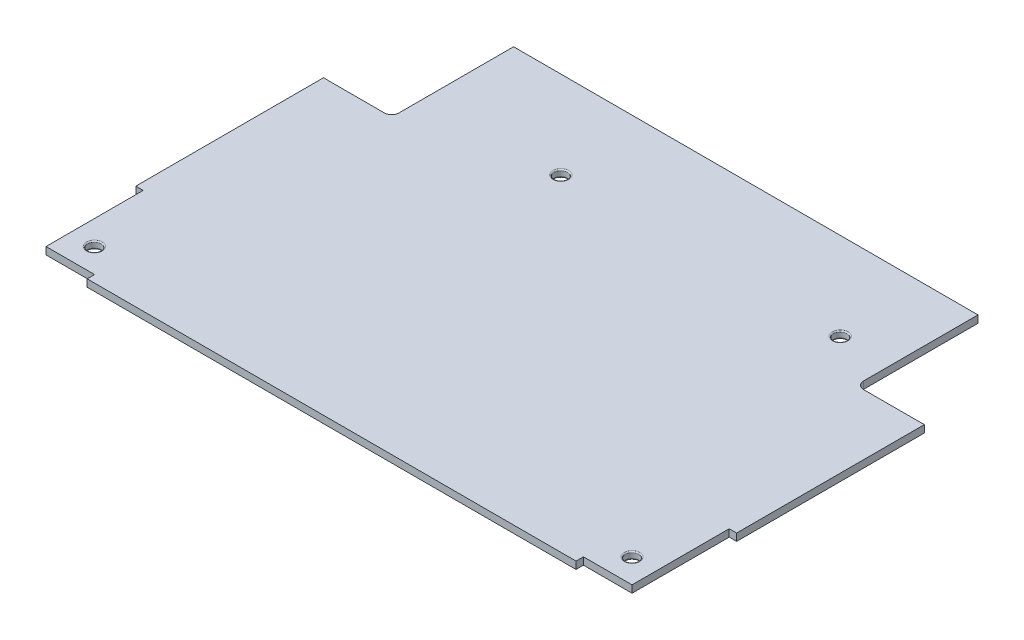
from build123d import *

# Parameters (mm, degrees)
SKETCH1_W           = 247.3
SKETCH1_H           = 170.475
BOSS_EXTRUDE1_DEPTH = 3
CUT_EXTRUDE2_DEPTH  = 151.212362694
SKETCH2_R           = 2.75
CUT_EXTRUDE1_DEPTH  = 151.212362694
FILLET1_R           = 0.5
SKETCH10_R          = 2.75
CUT_EXTRUDE8_DEPTH  = 151.212362694
FILLET4_R           = 0.5
CUT_EXTRUDE11_DEPTH = 151.212362694


with BuildPart() as part:
    # Sketch1 → Boss-Extrude1 (new body)
    with BuildSketch(Plane(origin=(0, 0, 0), x_dir=(1, 0, 0), z_dir=(0, 1, 0))):
        Rectangle(SKETCH1_W, SKETCH1_H)
    extrude(amount=BOSS_EXTRUDE1_DEPTH)

    # Sketch4 → Cut-Extrude2 (cut, through all)
    with BuildSketch(Plane(origin=(0, 3, 0), x_dir=(1, 0, 0), z_dir=(0, 1, 0))):
        Polygon((-123.65, -85.2375), (-120.6, -85.2375), (-100.6, -85.2375), (-100.6, -82.1875), (-120.6, -82.1875), (-120.6, -42.1875), (-123.65, -42.1875), align=None)
        Polygon((100.6, -85.2375), (100.6, -82.1875), (120.6, -82.1875), (120.6, -42.1875), (123.65, -42.1875), (123.65, -85.2375), (120.6, -85.2375), align=None)
    extrude(amount=-CUT_EXTRUDE2_DEPTH, mode=Mode.SUBTRACT)

    # Sketch2 → Cut-Extrude1 (cut, through all)
    with BuildSketch(Plane(origin=(0, 3, 0), x_dir=(1, 0, 0), z_dir=(0, 1, 0))):
        with Locations((-110.65, 55.2375)):
            Circle(SKETCH2_R)
        with Locations((110.65, 55.2375)):
            Circle(SKETCH2_R)
        with Locations((-110.65, -72.2375)):
            Circle(SKETCH2_R)
        with Locations((110.65, -72.2375)):
            Circle(SKETCH2_R)
    extrude(amount=-CUT_EXTRUDE1_DEPTH, mode=Mode.SUBTRACT)

    # Fillet1
    fillet1_edges = [part.edges().sort_by_distance(p)[0] for p in [
        (-113.4, 3, -55.2375),
        (-113.4, 0, -55.2375),
        (107.9, 3, -55.2375),
        (107.9, 0, -55.2375),
        (-113.4, 3, 72.2375),
        (-113.4, 0, 72.2375),
        (107.9, 3, 72.2375),
        (107.9, 0, 72.2375),
    ]]
    fillet(fillet1_edges, radius=FILLET1_R)

    # Sketch10 → Cut-Extrude8 (cut, through all)
    with BuildSketch(Plane(origin=(0, 3, 0), x_dir=(1, 0, 0), z_dir=(0, 1, 0))):
        with Locations((74.85, 49.2625)):
            Circle(SKETCH10_R)
        with Locations((-40.15, 49.2625)):
            Circle(SKETCH10_R)
    extrude(amount=-CUT_EXTRUDE8_DEPTH, mode=Mode.SUBTRACT)

    # Fillet4
    fillet4_edges = [part.edges().sort_by_distance(p)[0] for p in [
        (-42.9, 3, -49.2625),
        (-42.9, 0, -49.2625),
        (72.1, 3, -49.2625),
        (72.1, 0, -49.2625),
    ]]
    fillet(fillet4_edges, radius=FILLET4_R)

    # Sketch13 → Cut-Extrude11 (cut, through all)
    with BuildSketch(Plane.XZ):
        with BuildLine():
            Line((122.675, -35.0605), (98.625, -35.0605))
            ThreePointArc((98.625, -35.0605), (96.468324317, -35.953824317), (95.575, -38.1105))
            Line((95.575, -38.1105), (95.575, -95.6105))
            ThreePointArc((95.575, -95.6105), (96.468324317, -97.767175683), (98.625, -98.6605))
            Line((98.625, -98.6605), (122.675, -98.6605))
            ThreePointArc((122.675, -98.6605), (124.831675683, -97.767175683), (125.725, -95.6105))
            Line((125.725, -95.6105), (125.725, -38.1105))
            ThreePointArc((125.725, -38.1105), (124.831675683, -35.953824317), (122.675, -35.0605))
        make_face()
        with BuildLine():
            Line((-98.625, -35.0605), (-122.675, -35.0605))
            ThreePointArc((-122.675, -35.0605), (-124.831675683, -35.953824317), (-125.725, -38.1105))
            Line((-125.725, -38.1105), (-125.725, -95.6105))
            ThreePointArc((-125.725, -95.6105), (-124.831675683, -97.767175683), (-122.675, -98.6605))
            Line((-122.675, -98.6605), (-98.625, -98.6605))
            ThreePointArc((-98.625, -98.6605), (-96.468324317, -97.767175683), (-95.575, -95.6105))
            Line((-95.575, -95.6105), (-95.575, -38.1105))
            ThreePointArc((-95.575, -38.1105), (-96.468324317, -35.953824317), (-98.625, -35.0605))
        make_face()
    extrude(amount=-CUT_EXTRUDE11_DEPTH, mode=Mode.SUBTRACT)


solid = part.part
